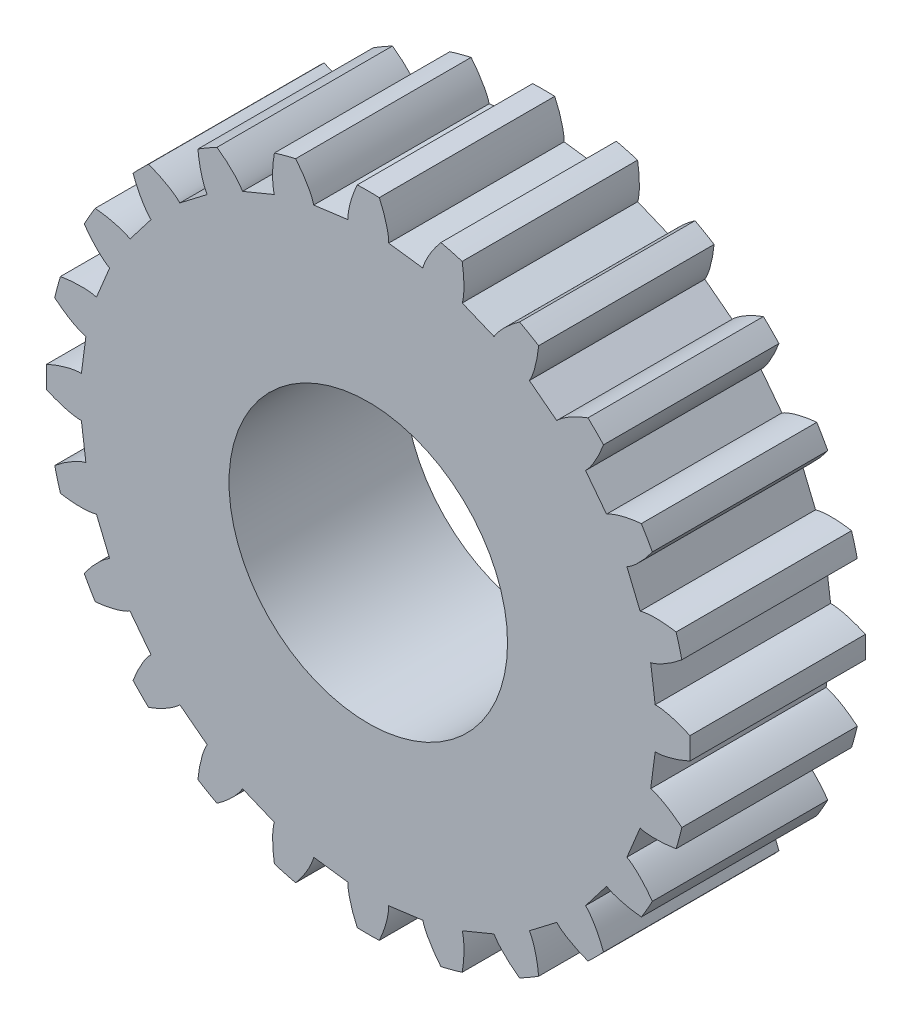
from build123d import *

# Parameters (mm, degrees)
SKETCH1_R               = 11.006666667
BOSS_EXTRUDE1_DEPTH     = 6
CUT_EXTRUDE2_DEPTH      = 7
CIRPATTERN1_COUNT       = 24
CUT_EXTRUDE4_DEPTH      = 8
CUT_EXTRUDE4_DEPTH_BACK = 8
SKETCH3_R               = 4.7625


with BuildPart() as part:
    # Sketch1 → Boss-Extrude1 (new body)
    with BuildSketch(Plane.XY):
        Circle(SKETCH1_R)
    extrude(amount=BOSS_EXTRUDE1_DEPTH)

    # Sketch2 → Cut-Extrude2 (cut, symmetric)
    with BuildSketch(Plane.XY):
        with BuildLine():
            add(Edge.make_bspline(
                [(9.811601549, 0.69774427), (9.816735612, 0.698054605), (9.826462672, 0.698325401), (9.842356124, 0.698425449), (9.873760862, 0.697746399), (9.909309677, 0.695780818), (9.949509524, 0.692377795), (9.992756609, 0.687536131), (10.029755148, 0.682661042), (10.066680285, 0.677112981), (10.10347658, 0.670968308), (10.148060104, 0.662794525), (10.201533151, 0.651977658), (10.264043807, 0.637853698), (10.334942782, 0.620087135), (10.407190915, 0.600109977), (10.478270187, 0.578915654), (10.550059068, 0.55573386), (10.619498527, 0.532051843), (10.691583262, 0.505641941), (10.758100398, 0.480343183), (10.832564391, 0.449994146), (10.89264098, 0.424916906), (10.954641836, 0.397339706), (10.984809153, 0.3836709), (11.000222617, 0.376581305)],
                knots=[0, 0, 0, 0, 0, 0.015083688, 0.02853182, 0.04661014, 0.092110526, 0.119476176, 0.146842496, 0.174208854, 0.201574956, 0.228941013, 0.256307345, 0.307035032, 0.361767352, 0.416499661, 0.471231937, 0.525964282, 0.580696616, 0.635428982, 0.690161387, 0.744893688, 0.799626082, 0.854358407, 0.909090914, 0.909090914, 0.909090914, 0.909090914, 0.909090914], degree=4))
            Line((11.000222617, 0.376581305), (59.96487193, 2.052835701))
            add(Edge.make_bspline(
                [(59.96487193, 2.052835701), (59.960934107, 2.167862468), (59.952417262, 2.391869008), (59.929284497, 2.956124274), (59.904333862, 3.387502943), (59.867724952, 4.011113833), (59.829984594, 4.518610932), (59.784812444, 5.095603669), (59.735960228, 5.630019941), (59.681269294, 6.189209553), (59.621877689, 6.733045979), (59.557395976, 7.284513803), (59.487586169, 7.831689295), (59.413397826, 8.378288341), (59.332952003, 8.92765445), (59.249564663, 9.468331778), (59.157663128, 10.022622521), (59.066533635, 10.551472884), (58.960829873, 11.120496483), (58.865934345, 11.620468961), (58.739893461, 12.232305909), (58.652344908, 12.655443405), (58.528649435, 13.20645934), (58.478898916, 13.425037363), (58.452931443, 13.537163872)],
                knots=[0.083333333, 0.083333333, 0.083333333, 0.083333333, 0.083333333, 0.123015873, 0.162698413, 0.202380952, 0.242063492, 0.281746032, 0.321428571, 0.361111111, 0.400793651, 0.44047619, 0.48015873, 0.51984127, 0.55952381, 0.599206349, 0.638888889, 0.678571429, 0.718253968, 0.757936508, 0.797619048, 0.837301587, 0.876984127, 0.916666667, 0.916666667, 0.916666667, 0.916666667, 0.916666667], degree=4))
            Line((58.452931443, 13.537163872), (10.722865535, 2.483317506))
            add(Edge.make_bspline(
                [(9.657868839, 1.865460134), (9.662908284, 1.866489165), (9.67237399, 1.868745145), (9.68775178, 1.872762035), (9.717910676, 1.881546091), (9.751739465, 1.892645407), (9.789688768, 1.90633696), (9.830209129, 1.922206818), (9.864685208, 1.936491719), (9.898916207, 1.951407663), (9.93286834, 1.966866543), (9.973817187, 1.986300876), (10.022668573, 2.01058901), (10.07939368, 2.040410657), (10.143278506, 2.075921844), (10.207894375, 2.113917489), (10.271066185, 2.152786303), (10.33440903, 2.193758526), (10.39535304, 2.234605852), (10.45814616, 2.278772761), (10.51584898, 2.320425386), (10.579920766, 2.369013005), (10.631459827, 2.408784723), (10.68421055, 2.451469255), (10.709812194, 2.472480184), (10.722865535, 2.483317506)],
                knots=[0, 0, 0, 0, 0, 0.015083688, 0.02853182, 0.04661014, 0.092110526, 0.119476176, 0.146842496, 0.174208854, 0.201574956, 0.228941013, 0.256307345, 0.307035032, 0.361767352, 0.416499661, 0.471231937, 0.525964282, 0.580696616, 0.635428982, 0.690161387, 0.744893688, 0.799626082, 0.854358407, 0.909090914, 0.909090914, 0.909090914, 0.909090914, 0.909090914], degree=4))
            Line((9.657868839, 1.865460134), (9.811601549, 0.69774427))
        make_face()
    cut_extrude2 = extrude(amount=CUT_EXTRUDE2_DEPTH, both=True, mode=Mode.SUBTRACT)

    # CirPattern1: Cut-Extrude2 ×24 about axis
    cirpattern1_axis = Axis((0, 0, -0.3), (0, 0, 1))
    for i in range(1, CIRPATTERN1_COUNT):
        add(cut_extrude2.rotate(cirpattern1_axis, i * 360 / CIRPATTERN1_COUNT), mode=Mode.SUBTRACT)

    # Sketch3 → Cut-Extrude4 (cut, two sides: drawn at the far end of the back side and taken through both)
    with BuildSketch(Plane.XY.offset(-CUT_EXTRUDE4_DEPTH_BACK)):
        Circle(SKETCH3_R)
    extrude(amount=CUT_EXTRUDE4_DEPTH + CUT_EXTRUDE4_DEPTH_BACK, mode=Mode.SUBTRACT)


solid = part.part
